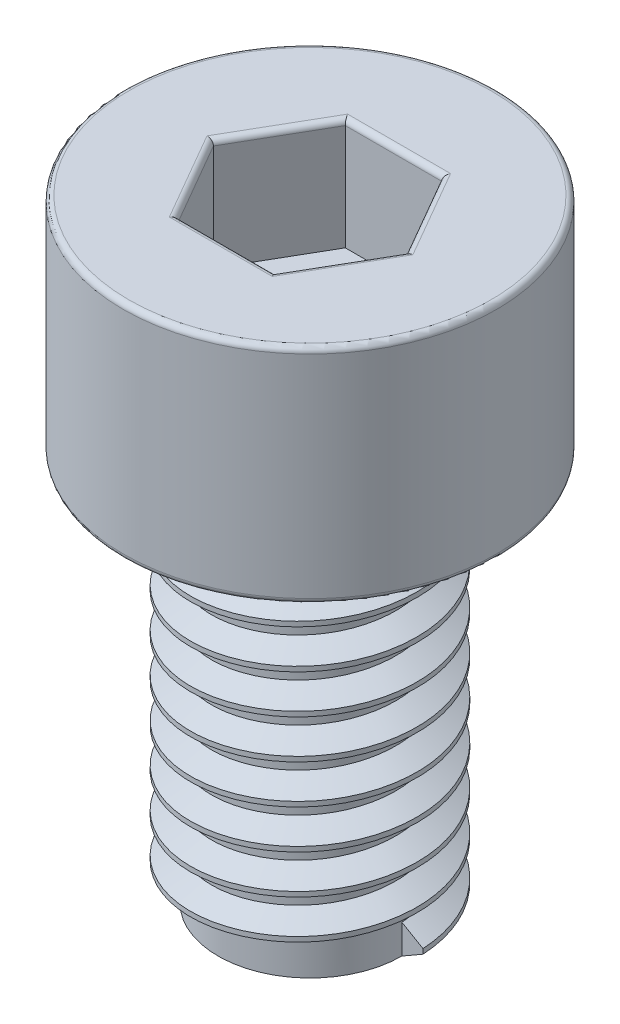
from build123d import *

# Parameters (mm, degrees)
SKETCH1_R           = 1.65
BOSS_EXTRUDE1_DEPTH = 7
SKETCH2_R           = 3.35
BOSS_EXTRUDE2_DEPTH = 4
THREAD1_PITCH       = 0.7
CUT_EXTRUDE1_DEPTH  = 2
FILLET1_R           = 0.1


with BuildPart() as part:
    # Sketch1 → Boss-Extrude1 (new body)
    with BuildSketch(Plane(origin=(0, 0, 0), x_dir=(1, 0, 0), z_dir=(0, 1, 0))):
        with Locations(Location((0, 0, 0), (0, 0, 270))):
            Circle(SKETCH1_R)
    extrude(amount=-BOSS_EXTRUDE1_DEPTH)

    # Sketch2 → Boss-Extrude2 (add)
    with BuildSketch(Plane(origin=(0, 0, 0), x_dir=(1, 0, 0), z_dir=(0, 1, 0))):
        with Locations(Location((0, 0, 0), (0, 0, 270))):
            Circle(SKETCH2_R)
    extrude(amount=BOSS_EXTRUDE2_DEPTH)

    # Thread1: the profile of Thread Profile1 profile screwed along a right-hand helix of 10 turns, 6 arcs to a turn; built about Z, then put on its axis
    thread1_z = Axis((0, 0, 0), (0, 0, 1))
    thread1_corners = [(1.6497, 0, -0.000173205), (2.028886112, 0, 0.218749999), (2.028886112, 0, 0.306249999), (1.6497, 0, 0.525173203)]
    with BuildLine(mode=Mode.PRIVATE) as thread1_profile:
        Line(thread1_corners[0], thread1_corners[1])
        Line(thread1_corners[1], thread1_corners[2])
        Line(thread1_corners[2], thread1_corners[3])
        Line(thread1_corners[3], thread1_corners[0])
    thread1_cap = Face(thread1_profile.wire())
    thread1_turn_angles = [0, 30, 60, 90, 120, 150, 180, 210, 240, 270, 300, 330, 360]
    thread1_turn_weights = [1, 0.8660254037844387, 1, 0.8660254037844387, 1, 0.8660254037844387, 1, 0.8660254037844387, 1, 0.8660254037844387, 1, 0.8660254037844387, 1]
    thread1_turn_rails = [Edge.make_bspline([Vector(p[0], p[1], 0).rotate(thread1_z, thread1_turn_angles[k]) / thread1_turn_weights[k] + Vector(0, 0, p[2] + THREAD1_PITCH * thread1_turn_angles[k] / 360) for k in range(13)], [0, 0, 0, 1, 1, 2, 2, 3, 3, 4, 4, 5, 5, 6, 6, 6], 2, thread1_turn_weights) for p in thread1_corners]
    thread1_turn_sides = [Face.make_surface_from_curves(thread1_turn_rails[p[0]], thread1_turn_rails[p[1]]) for p in [(0, 1), (1, 2), (2, 3), (3, 0)]]
    thread1 = Plane(origin=(0, -7, 0), x_dir=(1, 0, 0), z_dir=(0, 1, 0)) * Solid(Shell([*[p.moved(Location((0, 0, THREAD1_PITCH * i))) for i in range(10) for p in thread1_turn_sides], thread1_cap, thread1_cap.rotate(thread1_z, 3600).moved(Location((0, 0, THREAD1_PITCH * 3600 / 360)))]))
    add(thread1)

    # Sketch7 → Cut-Extrude1 (cut)
    with BuildSketch(Plane(origin=(0, 4, 0), x_dir=(1, 0, 0), z_dir=(0, 1, 0))):
        Polygon((1.732050808, 0), (0.866025404, 1.5), (-0.866025404, 1.5), (-1.732050808, 0), (-0.866025404, -1.5), (0.866025404, -1.5), align=None)
    extrude(amount=-CUT_EXTRUDE1_DEPTH, mode=Mode.SUBTRACT)

    # Fillet1
    fillet1_edges = [part.edges().sort_by_distance(p)[0] for p in [
        (1.299038106, 4, 0.75),
        (1.299038106, 4, -0.75),
        (0, 4, -1.5),
        (-1.299038106, 4, -0.75),
        (-1.299038106, 4, 0.75),
        (0, 4, 1.5),
        (0, 0, -3.35),
        (0, 4, -3.35),
    ]]
    fillet(fillet1_edges, radius=FILLET1_R)


solid = part.part
